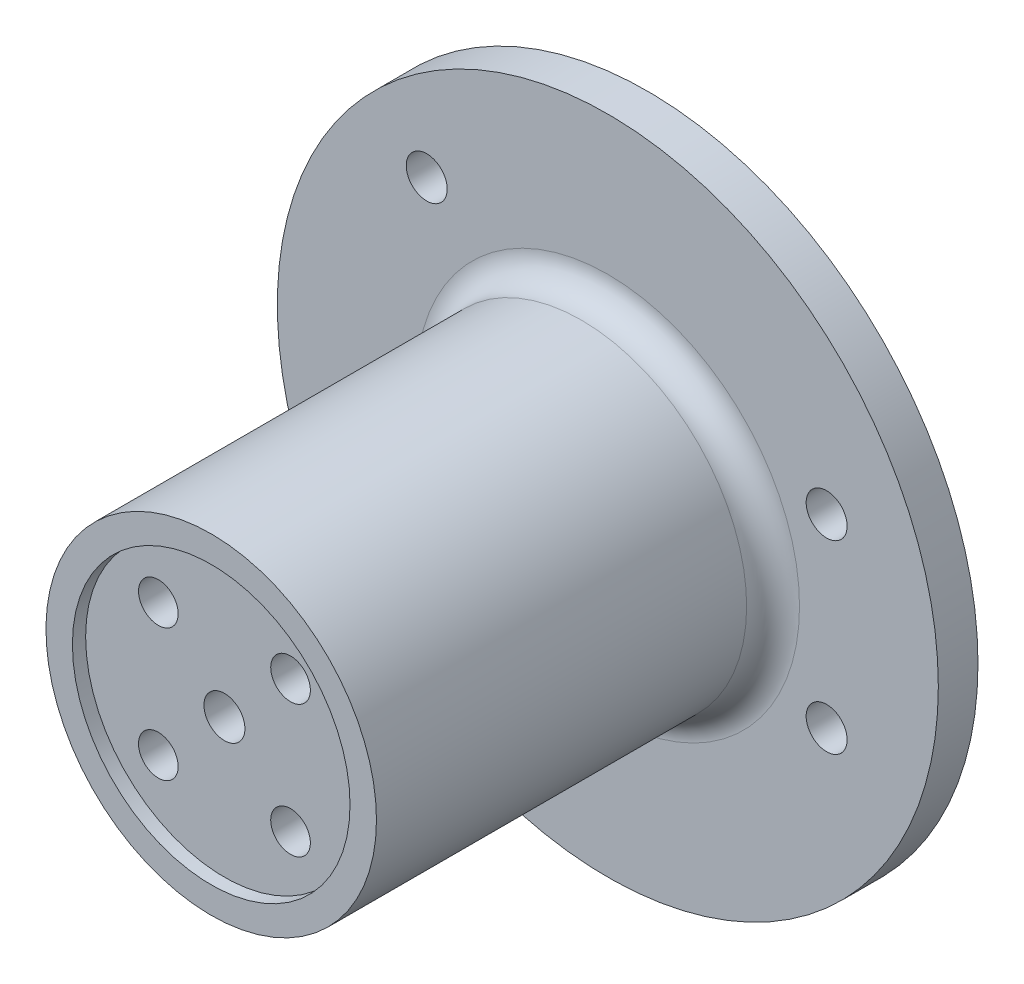
from build123d import *

# Parameters (mm, degrees)
SKETCH_2_R          = 25
SKETCH_2_R_2        = 1.55
EXTRUDE_1_DEPTH     = 3
SKETCH_3_R          = 12.5
EXTRUDE_2_DEPTH     = 30
SKETCH_4_R          = 4
CUT_EXTRUDE_1_DEPTH = 18
SKETCH_5_R          = 2.467025672
SKETCH_5_R_2        = 1.5
CUT_EXTRUDE_2_DEPTH = 33
SKETCH_6_R          = 10.5
CUT_EXTRUDE_3_DEPTH = 1
FILLET_1_R          = 2
SKETCH_8_R          = 9.571067812
EXTRUDE_4_DEPTH     = 18
SKETCH_9_R          = 3.5
SKETCH_9_R_2        = 3
CUT_EXTRUDE_7_DEPTH = 20
SKETCH_10_R         = 2.467025672
SKETCH_10_R_2       = 1.55
EXTRUDE_5_DEPTH     = 12


with BuildPart() as part:
    # 草图2 → 凸台-拉伸1 (new body)
    with BuildSketch(Plane.XY.offset(0.048295154)):
        with Locations((-1.050726952, -17)):
            Circle(SKETCH_2_R)
        with Locations((-14.75, -3)):
            Circle(SKETCH_2_R_2, mode=Mode.SUBTRACT)
        with Locations((-14.75, -17)):
            Circle(SKETCH_2_R_2, mode=Mode.SUBTRACT)
        with Locations((-14.75, -31)):
            Circle(SKETCH_2_R_2, mode=Mode.SUBTRACT)
        with Locations((15.5, -23.95)):
            Circle(SKETCH_2_R_2, mode=Mode.SUBTRACT)
        with Locations((15.5, -9.95)):
            Circle(SKETCH_2_R_2, mode=Mode.SUBTRACT)
    extrude(amount=EXTRUDE_1_DEPTH)

    # 草图3 → 凸台-拉伸2 (add)
    with BuildSketch(Plane.XY.offset(3.048295154)):
        with Locations(Location((-1.050726952, -17, 0), (0, 0, 184.300454135))):
            Circle(SKETCH_3_R)
    extrude(amount=EXTRUDE_2_DEPTH)

    # 草图4 → 切除-拉伸1 (cut)
    with BuildSketch(Plane(origin=(0, 0, 0.048295154), x_dir=(-1, 0, 0), z_dir=(0, 0, -1))):
        with BuildLine():
            ThreePointArc((8.550726952, -12), (6.050726952, -9.5), (3.550726952, -12))
            Line((3.550726952, -12), (6.050726952, -12))
            Line((6.050726952, -12), (6.050726952, -14.5))
            ThreePointArc((6.050726952, -14.5), (7.818493905, -13.767766953), (8.550726952, -12))
        make_face()
        with BuildLine():
            Line((6.050726952, -12), (3.550726952, -12))
            ThreePointArc((3.550726952, -12), (4.282959999, -13.767766953), (6.050726952, -14.5))
            Line((6.050726952, -14.5), (6.050726952, -12))
        make_face()
        with BuildLine():
            ThreePointArc((8.550726952, -22), (7.818493905, -20.232233047), (6.050726952, -19.5))
            Line((6.050726952, -19.5), (6.050726952, -22))
            Line((6.050726952, -22), (3.550726952, -22))
            ThreePointArc((3.550726952, -22), (6.050726952, -24.5), (8.550726952, -22))
        make_face()
        with BuildLine():
            Line((6.050726952, -22), (6.050726952, -19.5))
            ThreePointArc((6.050726952, -19.5), (4.282959999, -20.232233047), (3.550726952, -22))
            Line((3.550726952, -22), (6.050726952, -22))
        make_face()
        with BuildLine():
            ThreePointArc((-1.449273048, -22), (-2.181506095, -20.232233047), (-3.949273048, -19.5))
            Line((-3.949273048, -19.5), (-3.949273048, -22))
            Line((-3.949273048, -22), (-1.449273048, -22))
        make_face()
        with BuildLine():
            Line((-3.949273048, -22), (-3.949273048, -19.5))
            ThreePointArc((-3.949273048, -19.5), (-5.717040001, -23.767766953), (-1.449273048, -22))
            Line((-1.449273048, -22), (-3.949273048, -22))
        make_face()
        with BuildLine():
            Line((-3.949273048, -14.5), (-3.949273048, -12))
            Line((-3.949273048, -12), (-1.449273048, -12))
            ThreePointArc((-1.449273048, -12), (-5.717040001, -10.232233047), (-3.949273048, -14.5))
        make_face()
        with BuildLine():
            Line((-1.449273048, -12), (-3.949273048, -12))
            Line((-3.949273048, -12), (-3.949273048, -14.5))
            ThreePointArc((-3.949273048, -14.5), (-2.181506095, -13.767766953), (-1.449273048, -12))
        make_face()
        with Locations((1.050726952, -17)):
            Circle(SKETCH_4_R)
    extrude(amount=-CUT_EXTRUDE_1_DEPTH, mode=Mode.SUBTRACT)

    # 草图5 → 切除-拉伸2 (cut)
    with BuildSketch(Plane(origin=(0, 0, 0.048295154), x_dir=(-1, 0, 0), z_dir=(0, 0, -1))):
        with Locations((1.050726952, -17)):
            Circle(SKETCH_5_R)
        with Locations((6.050726952, -12)):
            Circle(SKETCH_5_R_2)
        with Locations((-3.949273048, -12)):
            Circle(SKETCH_5_R_2)
        with Locations((-3.949273048, -22)):
            Circle(SKETCH_5_R_2)
        with Locations((6.050726952, -22)):
            Circle(SKETCH_5_R_2)
    extrude(amount=-CUT_EXTRUDE_2_DEPTH, mode=Mode.SUBTRACT)

    # 草图6 → 切除-拉伸3 (cut)
    with BuildSketch(Plane.XY.offset(33.048295154)):
        with Locations((-1.050726952, -17)):
            Circle(SKETCH_6_R)
    extrude(amount=-CUT_EXTRUDE_3_DEPTH, mode=Mode.SUBTRACT)

    # 圆角1
    # the kernel refuses this fillet: 2 mm, written as the material it adds along each edge
    with BuildSketch(Plane(origin=(-1.050726952, -17, 3.048295154), x_dir=(-0.9999950652018734, -0.0031415874810074846, 0), z_dir=(-0.0031415874810074846, 0.9999950652018734, 0))) as fillet_1_piece_1_section:
        with BuildLine():
            CenterArc((12.5 + FILLET_1_R, FILLET_1_R), FILLET_1_R, 180, 90)
            Line((12.5, FILLET_1_R), (12.5, 0))
            Line((12.5, 0), (12.5 + FILLET_1_R, 0))
        make_face()
    fillet_1_piece_1 = revolve(axis=Axis((-1.050726952, -17, 3.048295154), (0, 0, 1)), revolution_arc=359.64, mode=Mode.PRIVATE)
    fillet_1_piece_1 = fillet_1_piece_1 - Plane(origin=(-14.75, -17, 3.605266613), x_dir=(1, 0, 0), z_dir=(0, 0, -1)) * Cylinder(1.55, 59, mode=Mode.PRIVATE)
    add(fillet_1_piece_1)

    # 草图8 → 凸台-拉伸4 (add)
    with BuildSketch(Plane(origin=(0, 0, 0.048295154), x_dir=(-1, 0, 0), z_dir=(0, 0, -1))):
        with Locations((1.050726952, -17)):
            Circle(SKETCH_8_R)
    extrude(amount=-EXTRUDE_4_DEPTH)

    # 草图9 → 切除-拉伸7 (cut)
    with BuildSketch(Plane(origin=(0, 0, 0.048295154), x_dir=(-1, 0, 0), z_dir=(0, 0, -1))):
        with BuildLine():
            ThreePointArc((-0.949273048, -12), (-6.070593392, -9.878679656), (-3.949273048, -15))
            Line((-3.949273048, -15), (-3.949273048, -12))
            Line((-3.949273048, -12), (-0.949273048, -12))
        make_face()
        with BuildLine():
            Line((-3.949273048, -12), (-3.949273048, -15))
            ThreePointArc((-3.949273048, -15), (-1.827952704, -14.121320344), (-0.949273048, -12))
            Line((-0.949273048, -12), (-3.949273048, -12))
        make_face()
        with Locations((1.050726952, -17)):
            Circle(SKETCH_9_R)
        with Locations((6.050726952, -12)):
            Circle(SKETCH_9_R_2)
        with Locations((6.050726952, -22)):
            Circle(SKETCH_9_R_2)
        with Locations((-3.949273048, -22)):
            Circle(SKETCH_9_R_2)
    extrude(amount=-CUT_EXTRUDE_7_DEPTH, mode=Mode.SUBTRACT)

    # 草图10 → 凸台-拉伸5 (add)
    with BuildSketch(Plane(origin=(0, 0, 20.048295154), x_dir=(-1, 0, 0), z_dir=(0, 0, -1))):
        with Locations((1.050726952, -17)):
            Circle(SKETCH_10_R)
        with Locations((1.050726952, -17)):
            Circle(SKETCH_10_R_2, mode=Mode.SUBTRACT)
    extrude(amount=-EXTRUDE_5_DEPTH)


solid = part.part
